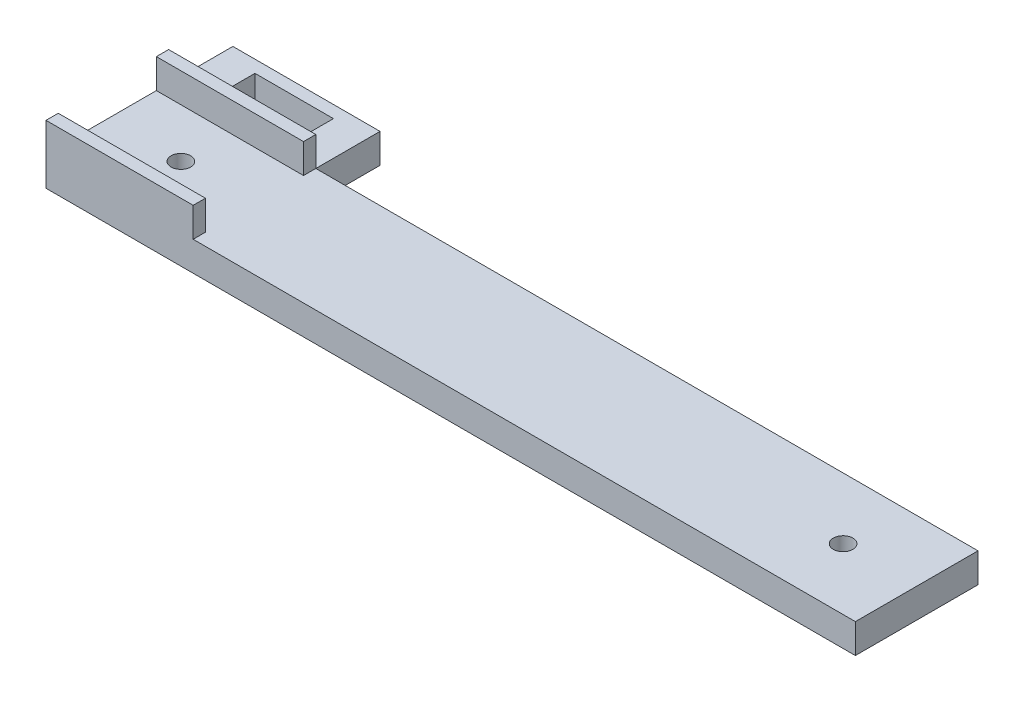
from build123d import *

# Parameters (mm, degrees)
SKETCH1_R           = 2
SKETCH1_W           = 16
SKETCH1_H           = 10.6
BOSS_EXTRUDE1_DEPTH = 6
SKETCH1_3_W         = 30
SKETCH1_3_H         = 2.5
BOSS_EXTRUDE2_DEPTH = 12
SKETCH2_R           = 2
CUT_EXTRUDE1_DEPTH  = 137.99361299


with BuildPart() as part:
    # Sketch1 → Boss-Extrude1 (new body)
    with BuildSketch(Plane(origin=(0, 0, 0), x_dir=(1, 0, 0), z_dir=(0, 1, 0))):
        Polygon((135, 2.5), (0, 2.5), (0, 15.6), (-30, 15.6), (-30, -22.5), (135, -22.5), align=None)
        with Locations((120, -10)):
            Circle(SKETCH1_R, mode=Mode.SUBTRACT)
        with Locations((-15, 7.8)):
            Rectangle(SKETCH1_W, SKETCH1_H, mode=Mode.SUBTRACT)
    extrude(amount=BOSS_EXTRUDE1_DEPTH)

    # Sketch1<3> → Boss-Extrude2 (add)
    with BuildSketch(Plane(origin=(0, 0, 0), x_dir=(1, 0, 0), z_dir=(0, 1, 0))):
        with Locations((-15, -21.25)):
            Rectangle(SKETCH1_3_W, SKETCH1_3_H)
        with Locations((-15, 1.25)):
            Rectangle(SKETCH1_3_W, SKETCH1_3_H)
    extrude(amount=BOSS_EXTRUDE2_DEPTH)

    # Sketch2 → Cut-Extrude1 (cut, through all)
    with BuildSketch(Plane(origin=(0, 6, 0), x_dir=(1, 0, 0), z_dir=(0, 1, 0))):
        with Locations((-15, -10)):
            Circle(SKETCH2_R)
    extrude(amount=-CUT_EXTRUDE1_DEPTH, mode=Mode.SUBTRACT)


solid = part.part
